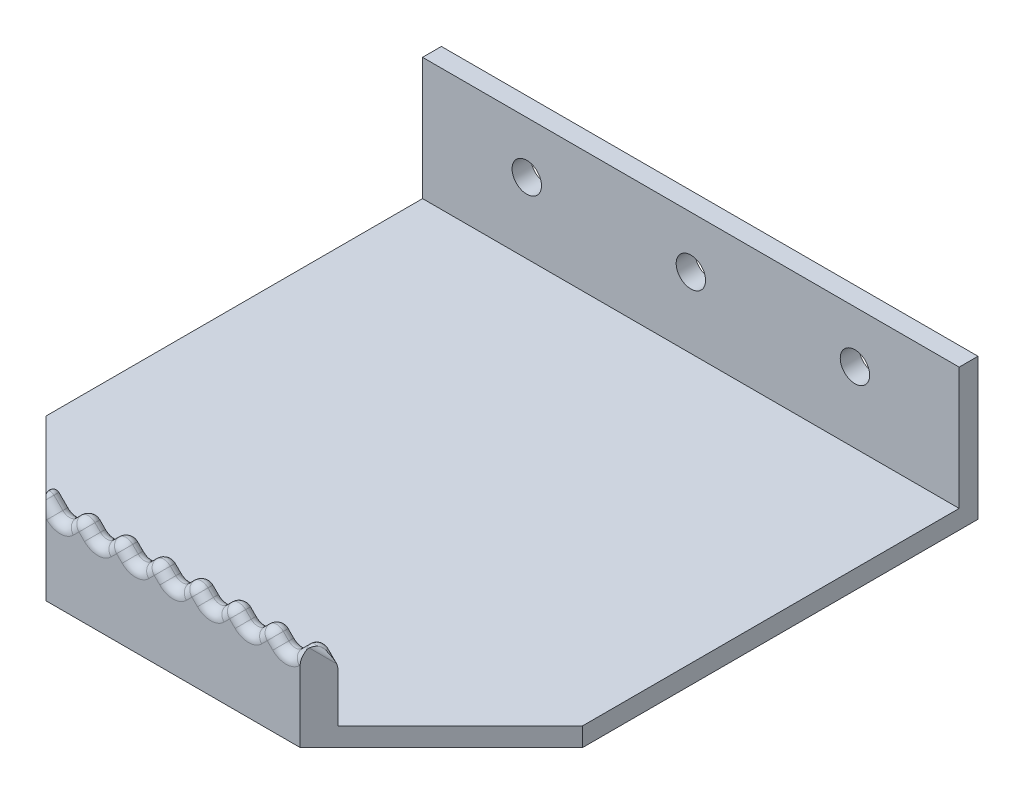
from build123d import *

# Parameters (mm, degrees)
SKETCH1_W           = 144.78
SKETCH1_H           = 38.1
BOSS_EXTRUDE1_DEPTH = 5.08
SKETCH2_W           = 144.78
SKETCH2_H           = 5.08
BOSS_EXTRUDE2_DEPTH = 139.7
CUT_EXTRUDE1_DEPTH  = 5.08
SKETCH5_R           = 3.9687500000000053
SKETCH5_R_2         = 3.9687499999999916
CUT_EXTRUDE2_DEPTH  = 5.08
BOSS_EXTRUDE3_DEPTH = 19.05
CUT_EXTRUDE3_START  = -5.08
CUT_EXTRUDE3_DEPTH  = 5.08
FILLET5_R           = 2.54
FILLET6_R           = 1.27


# Read off the part's stored shape, not the designer's step: Cut-Extrude3
with BuildPart() as part:
    # Sketch1 → Boss-Extrude1 (new body)
    with BuildSketch(Plane.XY):
        with Locations((72.39, 19.05)):
            Rectangle(SKETCH1_W, SKETCH1_H)
    extrude(amount=BOSS_EXTRUDE1_DEPTH)

    # Sketch2 → Boss-Extrude2 (add)
    with BuildSketch(Plane.XY.offset(5.08)):
        with Locations((72.39, 2.54)):
            Rectangle(SKETCH2_W, SKETCH2_H)
    extrude(amount=BOSS_EXTRUDE2_DEPTH)

    # Sketch4 → Cut-Extrude1 (cut)
    with BuildSketch(Plane(origin=(0, 5.08, 0), x_dir=(1, 0, 0), z_dir=(0, 1, 0))):
        Polygon((0, -144.78), (0, -106.67999999999999), (38.10000000000043, -144.78), align=None)
        Polygon((144.78, -144.78), (106.67999999999961, -144.78), (144.78, -106.67999999999999), align=None)
    extrude(amount=-CUT_EXTRUDE1_DEPTH, mode=Mode.SUBTRACT)

    # Sketch5 → Cut-Extrude2 (cut)
    with BuildSketch(Plane.XY.offset(5.08)):
        with Locations((72.39, 24.12999999999999)):
            Circle(SKETCH5_R)
        with Locations((28.117799999999992, 24.12999999999999)):
            Circle(SKETCH5_R)
        with Locations(Location((116.6622, 24.12999999999999, 0), (0, 0, 180))):
            Circle(SKETCH5_R_2)
    extrude(amount=-CUT_EXTRUDE2_DEPTH, mode=Mode.SUBTRACT)

    # Sketch6 → Boss-Extrude3 (add)
    with BuildSketch(Plane(origin=(0, 5.08, 0), x_dir=(1, 0, 0), z_dir=(0, 1, 0))):
        Polygon((38.10000000000043, -144.78), (106.67999999999961, -144.78), (111.76, -139.7), (33.020000000000444, -139.7), align=None)
    extrude(amount=BOSS_EXTRUDE3_DEPTH)

    # Cut-Extrude3 outline → Cut-Extrude3 (cut)
    with BuildSketch(Plane.XY.offset(144.78).offset(CUT_EXTRUDE3_START)):
        Polygon((77.47, 24.13), (67.31, 24.13), (72.39, 19.05), align=None)
        Polygon((118.11, 24.13), (107.95, 24.13), (113.03, 19.05), align=None)
        Polygon((107.95, 24.13), (97.79, 24.13), (102.87, 19.05), align=None)
        Polygon((97.79, 24.13), (87.63, 24.13), (92.71, 19.05), align=None)
        Polygon((87.63, 24.13), (77.47, 24.13), (82.55, 19.05), align=None)
        Polygon((62.23, 19.05), (67.31, 24.13), (57.15, 24.13), align=None)
        Polygon((31.75, 19.05), (36.83, 24.13), (26.67, 24.13), align=None)
        Polygon((41.91, 19.05), (46.99, 24.13), (36.83, 24.13), align=None)
        Polygon((52.07, 19.05), (57.15, 24.13), (46.99, 24.13), align=None)
    extrude(amount=CUT_EXTRUDE3_DEPTH, mode=Mode.SUBTRACT)

    # Fillet5
    # the kernel refuses this fillet: 2.54 mm, written as the material it adds along each edge
    with BuildSketch(Plane(origin=(72.39, 19.05, 139.7), x_dir=(-0.7071067811865475, 0.7071067811865475, 0), z_dir=(0, 0, 1))) as fillet5_piece_1:
        with BuildLine():
            CenterArc((FILLET5_R, -FILLET5_R), FILLET5_R, 90.00000000000011, 90.00000000000017)
            Line((-2.49e-15, -FILLET5_R), (0, 0))
            Line((0, 0), (FILLET5_R, 3e-17))
        make_face()
    extrude(amount=5.0800000000000125)
    with BuildSketch(Plane(origin=(52.07, 19.05, 139.7), x_dir=(-0.7071067811865482, 0.7071067811865469, 0), z_dir=(0, 0, 1))) as fillet5_piece_2:
        with BuildLine():
            CenterArc((FILLET5_R, -FILLET5_R), FILLET5_R, 89.9999999999999, 90.00000000000011)
            Line((-4.95e-15, -FILLET5_R), (0, 0))
            Line((0, 0), (FILLET5_R, 1.2e-16))
        make_face()
    extrude(amount=5.0800000000000125)
    with BuildSketch(Plane(origin=(82.55, 19.05, 139.7), x_dir=(-0.7071067811865482, 0.7071067811865468, 0), z_dir=(0, 0, 1))) as fillet5_piece_3:
        with BuildLine():
            CenterArc((FILLET5_R, -FILLET5_R), FILLET5_R, 90.00000000000006, 90.00000000000023)
            Line((-5.01e-15, -FILLET5_R), (0, 0))
            Line((0, 0), (FILLET5_R, -1.9e-16))
        make_face()
    extrude(amount=5.0800000000000125)
    with BuildSketch(Plane(origin=(62.23, 19.05, 139.7), x_dir=(-0.7071067811865475, 0.7071067811865475, 0), z_dir=(0, 0, 1))) as fillet5_piece_4:
        with BuildLine():
            CenterArc((FILLET5_R, -FILLET5_R), FILLET5_R, 89.99999999999994, 90)
            Line((-4.91e-15, -FILLET5_R), (0, 0))
            Line((0, 0), (FILLET5_R, 3e-17))
        make_face()
    extrude(amount=5.0800000000000125)
    with BuildSketch(Plane(origin=(41.91, 19.05, 139.7), x_dir=(-0.7071067811865468, 0.7071067811865482, 0), z_dir=(0, 0, 1))) as fillet5_piece_5:
        with BuildLine():
            CenterArc((FILLET5_R, -FILLET5_R), FILLET5_R, 90, 89.99999999999994)
            Line((-2.41e-15, -FILLET5_R), (0, 0))
            Line((0, 0), (FILLET5_R, 5e-17))
        make_face()
    extrude(amount=5.0800000000000125)
    with BuildSketch(Plane(origin=(102.87, 19.05, 139.7), x_dir=(0.7071067811865482, 0.7071067811865468, 0), z_dir=(0, 0, 1))) as fillet5_piece_6:
        with BuildLine():
            CenterArc((FILLET5_R, FILLET5_R), FILLET5_R, 180.0000000000001, 89.99999999999983)
            Line((-2.56e-15, FILLET5_R), (0, 0))
            Line((0, 0), (FILLET5_R, 1.9e-16))
        make_face()
    extrude(amount=5.0800000000000125)
    with BuildSketch(Plane(origin=(92.71, 19.05, 139.7), x_dir=(-0.7071067811865475, 0.7071067811865475, 0), z_dir=(0, 0, 1))) as fillet5_piece_7:
        with BuildLine():
            CenterArc((FILLET5_R, -FILLET5_R), FILLET5_R, 90.00000000000011, 89.99999999999974)
            Line((-2.54e-15, -FILLET5_R), (0, 0))
            Line((0, 0), (FILLET5_R, 3e-17))
        make_face()
    extrude(amount=5.0800000000000125)
    # the kernel refuses this fillet: 2.54 mm, written as the material it takes off along each edge
    with BuildSketch(Plane(origin=(57.15, 24.13, 133.35), x_dir=(-0.7071067811865469, -0.7071067811865483, 0), z_dir=(0, 0, 1))) as fillet5_2_piece_1:
        with BuildLine():
            CenterArc((FILLET5_R, FILLET5_R), FILLET5_R, 179.9999999999999, 90.00000000000011)
            Line((5.11e-15, FILLET5_R), (0, 0))
            Line((0, 0), (FILLET5_R, -1.5e-16))
        make_face()
    extrude(amount=17.78, mode=Mode.SUBTRACT)
    with BuildSketch(Plane(origin=(77.47, 24.13, 133.35000000000002), x_dir=(-0.7071067811865482, -0.7071067811865468, 0), z_dir=(0, 0, 1))) as fillet5_2_piece_2:
        with BuildLine():
            CenterArc((FILLET5_R, FILLET5_R), FILLET5_R, 180.0000000000001, 89.99999999999983)
            Line((-2.56e-15, FILLET5_R), (0, 0))
            Line((0, 0), (FILLET5_R, 1.9e-16))
        make_face()
    extrude(amount=17.779999999999944, mode=Mode.SUBTRACT)
    with BuildSketch(Plane(origin=(87.63, 24.129999999999995, 133.35000000000002), x_dir=(-0.7071067811865489, -0.7071067811865461, 0), z_dir=(0, 0, 1))) as fillet5_2_piece_3:
        with BuildLine():
            CenterArc((FILLET5_R, FILLET5_R), FILLET5_R, 180.00000000000014, 89.99999999999989)
            Line((-7.6e-15, FILLET5_R), (0, 0))
            Line((0, 0), (FILLET5_R, -2e-17))
        make_face()
    extrude(amount=17.779999999999944, mode=Mode.SUBTRACT)
    with BuildSketch(Plane(origin=(67.31, 24.13, 133.35000000000002), x_dir=(-0.7071067811865475, -0.7071067811865475, 0), z_dir=(0, 0, 1))) as fillet5_2_piece_4:
        with BuildLine():
            CenterArc((FILLET5_R, FILLET5_R), FILLET5_R, 180.0000000000001, 89.99999999999977)
            Line((-3e-17, FILLET5_R), (0, 0))
            Line((0, 0), (FILLET5_R, -3e-17))
        make_face()
    extrude(amount=17.779999999999944, mode=Mode.SUBTRACT)
    with BuildSketch(Plane(origin=(46.99, 24.13, 133.35), x_dir=(-0.7071067811865476, -0.7071067811865476, 0), z_dir=(0, 0, 1))) as fillet5_2_piece_5:
        with BuildLine():
            CenterArc((FILLET5_R, FILLET5_R), FILLET5_R, 179.99999999999994, 89.99999999999994)
            Line((7.48e-15, FILLET5_R), (0, 0))
            Line((0, 0), (FILLET5_R, 9e-17))
        make_face()
    extrude(amount=17.78, mode=Mode.SUBTRACT)
    with BuildSketch(Plane(origin=(97.79, 24.13, 133.35000000000002), x_dir=(-0.7071067811865489, -0.7071067811865461, 0), z_dir=(0, 0, 1))) as fillet5_2_piece_6:
        with BuildLine():
            CenterArc((FILLET5_R, FILLET5_R), FILLET5_R, 180.00000000000014, 89.99999999999989)
            Line((-7.6e-15, FILLET5_R), (0, 0))
            Line((0, 0), (FILLET5_R, -2e-17))
        make_face()
    extrude(amount=17.779999999999916, mode=Mode.SUBTRACT)
    # the kernel refuses this fillet: 2.54 mm, written as the material it takes off along each edge
    with BuildSketch(Plane(origin=(74.18605122421384, 20.84605122421384, 139.7), x_dir=(0.7071067811865476, -0.7071067811865476, 0), z_dir=(0.7071067811865476, 0.7071067811865476, 0)), Plane(origin=(84.34605122421384, 20.84605122421384, 139.7), x_dir=(0.7071067811865476, -0.7071067811865476, 0), z_dir=(0.7071067811865476, 0.7071067811865476, 0))) as fillet5_3_piece_1:
        with BuildLine():
            CenterArc((FILLET5_R, -FILLET5_R), FILLET5_R, 90, 90)
            Line((-2.51e-15, -FILLET5_R), (0, 0))
            Line((0, 0), (FILLET5_R, 0))
        make_face()
    extrude(amount=2.104204896855315, mode=Mode.SUBTRACT)
    with BuildSketch(Plane(origin=(69.10605122421383, 22.333948775786173, 139.7), x_dir=(-0.7071067811865476, -0.7071067811865476, 0), z_dir=(0.7071067811865476, -0.7071067811865476, 0)), Plane(origin=(89.42605122421382, 22.333948775786173, 139.7), x_dir=(-0.7071067811865476, -0.7071067811865476, 0), z_dir=(0.7071067811865476, -0.7071067811865476, 0))) as fillet5_3_piece_2:
        with BuildLine():
            CenterArc((FILLET5_R, -FILLET5_R), FILLET5_R, 90, 90)
            Line((0, -FILLET5_R), (0, 0))
            Line((0, 0), (FILLET5_R, 0))
        make_face()
    extrude(amount=2.1042048968553324, mode=Mode.SUBTRACT)
    with BuildSketch(Plane(origin=(69.10605122421383, 22.333948775786173, 144.78), x_dir=(-0.7071067811865476, -0.7071067811865476, 0), z_dir=(0.7071067811865476, -0.7071067811865476, 0)), Plane(origin=(89.42605122421382, 22.333948775786173, 144.78), x_dir=(-0.7071067811865476, -0.7071067811865476, 0), z_dir=(0.7071067811865476, -0.7071067811865476, 0))) as fillet5_3_piece_3:
        with BuildLine():
            CenterArc((FILLET5_R, FILLET5_R), FILLET5_R, 180, 90)
            Line((0, FILLET5_R), (0, 0))
            Line((0, 0), (FILLET5_R, 0))
        make_face()
    extrude(amount=2.1042048968553324, mode=Mode.SUBTRACT)
    with BuildSketch(Plane(origin=(74.18605122421384, 20.84605122421384, 144.78), x_dir=(0.7071067811865476, -0.7071067811865476, 0), z_dir=(0.7071067811865476, 0.7071067811865476, 0)), Plane(origin=(84.34605122421384, 20.84605122421384, 144.78), x_dir=(0.7071067811865476, -0.7071067811865476, 0), z_dir=(0.7071067811865476, 0.7071067811865476, 0))) as fillet5_3_piece_4:
        with BuildLine():
            CenterArc((FILLET5_R, FILLET5_R), FILLET5_R, 180, 90)
            Line((-2.51e-15, FILLET5_R), (0, 0))
            Line((0, 0), (FILLET5_R, 0))
        make_face()
    extrude(amount=2.104204896855315, mode=Mode.SUBTRACT)
    with BuildSketch(Plane(origin=(53.866051224213834, 20.846051224213834, 139.7), x_dir=(0.7071067811865476, -0.7071067811865476, 0), z_dir=(0.7071067811865476, 0.7071067811865476, 0))) as fillet5_3_piece_5:
        with BuildLine():
            CenterArc((FILLET5_R, -FILLET5_R), FILLET5_R, 90, 90)
            Line((0, -FILLET5_R), (0, 0))
            Line((0, 0), (FILLET5_R, 0))
        make_face()
    extrude(amount=2.1042048968553098, mode=Mode.SUBTRACT)
    with BuildSketch(Plane(origin=(48.786051224213836, 22.333948775786162, 139.7), x_dir=(-0.7071067811865476, -0.7071067811865476, 0), z_dir=(0.7071067811865476, -0.7071067811865476, 0))) as fillet5_3_piece_6:
        with BuildLine():
            CenterArc((FILLET5_R, -FILLET5_R), FILLET5_R, 90, 90)
            Line((7.54e-15, -FILLET5_R), (0, 0))
            Line((0, 0), (FILLET5_R, 0))
        make_face()
    extrude(amount=2.1042048968553124, mode=Mode.SUBTRACT)
    with BuildSketch(Plane(origin=(48.786051224213836, 22.333948775786162, 144.78), x_dir=(-0.7071067811865476, -0.7071067811865476, 0), z_dir=(0.7071067811865476, -0.7071067811865476, 0))) as fillet5_3_piece_7:
        with BuildLine():
            CenterArc((FILLET5_R, FILLET5_R), FILLET5_R, 180, 90)
            Line((0, FILLET5_R), (0, 0))
            Line((0, 0), (FILLET5_R, 0))
        make_face()
    extrude(amount=2.1042048968553124, mode=Mode.SUBTRACT)
    with BuildSketch(Plane(origin=(53.866051224213834, 20.846051224213834, 144.78), x_dir=(0.7071067811865476, -0.7071067811865476, 0), z_dir=(0.7071067811865476, 0.7071067811865476, 0))) as fillet5_3_piece_8:
        with BuildLine():
            CenterArc((FILLET5_R, FILLET5_R), FILLET5_R, 180, 90)
            Line((0, FILLET5_R), (0, 0))
            Line((0, 0), (FILLET5_R, 0))
        make_face()
    extrude(amount=2.1042048968553098, mode=Mode.SUBTRACT)
    with BuildSketch(Plane(origin=(79.26605122421383, 22.333948775786173, 139.7), x_dir=(-0.7071067811865476, -0.7071067811865476, 0), z_dir=(0.7071067811865476, -0.7071067811865476, 0)), Plane(origin=(99.58605122421383, 22.333948775786173, 139.7), x_dir=(-0.7071067811865476, -0.7071067811865476, 0), z_dir=(0.7071067811865476, -0.7071067811865476, 0))) as fillet5_3_piece_9:
        with BuildLine():
            CenterArc((FILLET5_R, -FILLET5_R), FILLET5_R, 90, 90)
            Line((0, -FILLET5_R), (0, 0))
            Line((0, 0), (FILLET5_R, 0))
        make_face()
    extrude(amount=2.104204896855335, mode=Mode.SUBTRACT)
    with BuildSketch(Plane(origin=(79.26605122421383, 22.333948775786173, 144.78), x_dir=(-0.7071067811865476, -0.7071067811865476, 0), z_dir=(0.7071067811865476, -0.7071067811865476, 0)), Plane(origin=(99.58605122421383, 22.333948775786173, 144.78), x_dir=(-0.7071067811865476, -0.7071067811865476, 0), z_dir=(0.7071067811865476, -0.7071067811865476, 0))) as fillet5_3_piece_10:
        with BuildLine():
            CenterArc((FILLET5_R, FILLET5_R), FILLET5_R, 180, 90)
            Line((0, FILLET5_R), (0, 0))
            Line((0, 0), (FILLET5_R, 0))
        make_face()
    extrude(amount=2.104204896855335, mode=Mode.SUBTRACT)
    with BuildSketch(Plane(origin=(64.02605122421383, 20.846051224213827, 139.7), x_dir=(0.7071067811865471, -0.707106781186548, 0), z_dir=(0.707106781186548, 0.707106781186547, 0))) as fillet5_3_piece_11:
        with BuildLine():
            CenterArc((FILLET5_R, -FILLET5_R), FILLET5_R, 90, 90)
            Line((-2.51e-15, -FILLET5_R), (0, 0))
            Line((0, 0), (FILLET5_R, 0))
        make_face()
    extrude(amount=2.1042048968553324, mode=Mode.SUBTRACT)
    with BuildSketch(Plane(origin=(58.94605122421383, 22.333948775786162, 139.7), x_dir=(-0.7071067811865476, -0.7071067811865476, 0), z_dir=(0.7071067811865476, -0.7071067811865476, 0))) as fillet5_3_piece_12:
        with BuildLine():
            CenterArc((FILLET5_R, -FILLET5_R), FILLET5_R, 90, 90)
            Line((2.51e-15, -FILLET5_R), (0, 0))
            Line((0, 0), (FILLET5_R, 0))
        make_face()
    extrude(amount=2.1042048968553226, mode=Mode.SUBTRACT)
    with BuildSketch(Plane(origin=(58.94605122421383, 22.333948775786162, 144.78), x_dir=(-0.7071067811865476, -0.7071067811865476, 0), z_dir=(0.7071067811865476, -0.7071067811865476, 0))) as fillet5_3_piece_13:
        with BuildLine():
            CenterArc((FILLET5_R, FILLET5_R), FILLET5_R, 180, 90)
            Line((2.51e-15, FILLET5_R), (0, 0))
            Line((0, 0), (FILLET5_R, 0))
        make_face()
    extrude(amount=2.1042048968553226, mode=Mode.SUBTRACT)
    with BuildSketch(Plane(origin=(64.02605122421383, 20.846051224213827, 144.78), x_dir=(0.7071067811865471, -0.707106781186548, 0), z_dir=(0.707106781186548, 0.707106781186547, 0))) as fillet5_3_piece_14:
        with BuildLine():
            CenterArc((FILLET5_R, FILLET5_R), FILLET5_R, 180, 90)
            Line((-2.51e-15, FILLET5_R), (0, 0))
            Line((0, 0), (FILLET5_R, 0))
        make_face()
    extrude(amount=2.1042048968553324, mode=Mode.SUBTRACT)
    with BuildSketch(Plane(origin=(32.339871939465425, 28.62012806053456, 139.7), x_dir=(-0.7071067811865475, -0.7071067811865475, 0), z_dir=(0.7071067811865476, -0.7071067811865476, 0))) as fillet5_3_piece_15:
        with BuildLine():
            CenterArc((FILLET5_R, -FILLET5_R), FILLET5_R, 90, 90)
            Line((-2.51e-15, -FILLET5_R), (0, 0))
            Line((0, 0), (FILLET5_R, 0))
        make_face()
    extrude(amount=10.994204896855315, mode=Mode.SUBTRACT)
    with BuildSketch(Plane(origin=(33.609871939465854, 27.350128060534143, 144.78), x_dir=(-0.7071067811865476, -0.7071067811865476, 0), z_dir=(0.7071067811865476, -0.7071067811865476, 0))) as fillet5_3_piece_16:
        with BuildLine():
            CenterArc((FILLET5_R, FILLET5_R), FILLET5_R, 180, 90)
            Line((0, FILLET5_R), (0, 0))
            Line((0, 0), (FILLET5_R, 0))
        make_face()
    extrude(amount=9.198153672640885, mode=Mode.SUBTRACT)
    with BuildSketch(Plane(origin=(43.70605122421383, 20.84605122421383, 144.78), x_dir=(0.7071067811865471, -0.707106781186548, 0), z_dir=(0.707106781186548, 0.707106781186547, 0))) as fillet5_3_piece_17:
        with BuildLine():
            CenterArc((FILLET5_R, FILLET5_R), FILLET5_R, 180, 90)
            Line((-2.51e-15, FILLET5_R), (0, 0))
            Line((0, 0), (FILLET5_R, 0))
        make_face()
    extrude(amount=2.10420489685532, mode=Mode.SUBTRACT)
    with BuildSketch(Plane(origin=(43.70605122421383, 20.84605122421383, 139.7), x_dir=(0.707106781186547, -0.7071067811865481, 0), z_dir=(0.707106781186548, 0.707106781186547, 0))) as fillet5_3_piece_18:
        with BuildLine():
            CenterArc((FILLET5_R, -FILLET5_R), FILLET5_R, 90, 90)
            Line((0, -FILLET5_R), (0, 0))
            Line((0, 0), (FILLET5_R, 0))
        make_face()
    extrude(amount=2.10420489685532, mode=Mode.SUBTRACT)
    with BuildSketch(Plane(origin=(104.66605122421383, 20.846051224213827, 144.78), x_dir=(0.7071067811865476, -0.7071067811865476, 0), z_dir=(0.7071067811865476, 0.7071067811865476, 0))) as fillet5_3_piece_19:
        with BuildLine():
            CenterArc((FILLET5_R, FILLET5_R), FILLET5_R, 180, 90)
            Line((-2.51e-15, FILLET5_R), (0, 0))
            Line((0, 0), (FILLET5_R, 0))
        make_face()
    extrude(amount=9.198153672640936, mode=Mode.SUBTRACT)
    with BuildSketch(Plane(origin=(104.66605122421383, 20.846051224213827, 139.7), x_dir=(-7e-16, 7e-16, 1), z_dir=(0.7071067811865476, 0.7071067811865476, 0))) as fillet5_3_piece_20:
        with BuildLine():
            CenterArc((FILLET5_R, FILLET5_R), FILLET5_R, 180.00000000000006, 90)
            Line((-2.51e-15, FILLET5_R), (0, 0))
            Line((0, 0), (FILLET5_R, 0))
        make_face()
    extrude(amount=10.994204896855322, mode=Mode.SUBTRACT)
    with BuildSketch(Plane(origin=(94.50605122421382, 20.846051224213824, 139.7), x_dir=(0.7071067811865465, -0.7071067811865486, 0), z_dir=(0.7071067811865486, 0.7071067811865466, 0))) as fillet5_3_piece_21:
        with BuildLine():
            CenterArc((FILLET5_R, -FILLET5_R), FILLET5_R, 90, 90)
            Line((0, -FILLET5_R), (0, 0))
            Line((0, 0), (FILLET5_R, 0))
        make_face()
    extrude(amount=2.10420489685535, mode=Mode.SUBTRACT)
    with BuildSketch(Plane(origin=(94.50605122421382, 20.846051224213824, 144.78), x_dir=(0.7071067811865465, -0.7071067811865486, 0), z_dir=(0.7071067811865486, 0.7071067811865466, 0))) as fillet5_3_piece_22:
        with BuildLine():
            CenterArc((FILLET5_R, FILLET5_R), FILLET5_R, 180, 90)
            Line((0, FILLET5_R), (0, 0))
            Line((0, 0), (FILLET5_R, 0))
        make_face()
    extrude(amount=2.10420489685535, mode=Mode.SUBTRACT)
    with BuildSketch(Plane(origin=(92.71, 22.64210244842766, 144.78), x_dir=(-0.7071067811865461, -0.7071067811865489, 0), z_dir=(-0.7071067811865489, 0.7071067811865461, 0))) as fillet5_3_piece_23:
        with BuildLine():
            CenterArc((2.539999999999999 + FILLET5_R, -FILLET5_R), FILLET5_R, 90, 90)
            Line((2.539999999999999, -FILLET5_R), (2.539999999999999, 0))
            Line((2.539999999999999, 0), (2.539999999999999 + FILLET5_R, 0))
        make_face()
    revolve(axis=Axis((92.71, 22.64210244842766, 144.78), (0, 0, 1)), revolution_arc=89.99999999999972, mode=Mode.SUBTRACT)
    with BuildSketch(Plane(origin=(97.79, 20.537897551572346, 144.78), x_dir=(-0.7071067811865461, 0.7071067811865489, 0), z_dir=(-0.7071067811865489, -0.7071067811865461, 0))) as fillet5_3_piece_24:
        with BuildLine():
            CenterArc((2.539999999999999 - FILLET5_R, FILLET5_R), FILLET5_R, 270, 90)
            Line((2.539999999999999, FILLET5_R), (2.539999999999999, 0))
            Line((2.539999999999999, 0), (2.539999999999999 - FILLET5_R, 0))
        make_face()
    revolve(axis=Axis((97.79, 20.537897551572346, 144.78), (0, 0, -1)), revolution_arc=89.99999999999977, mode=Mode.SUBTRACT)
    with BuildSketch(Plane(origin=(87.63, 20.537897551572343, 144.78), x_dir=(-0.7071067811865461, 0.7071067811865489, 0), z_dir=(-0.7071067811865489, -0.7071067811865461, 0))) as fillet5_3_piece_25:
        with BuildLine():
            CenterArc((2.539999999999999 - FILLET5_R, FILLET5_R), FILLET5_R, 270, 90)
            Line((2.539999999999999, FILLET5_R), (2.539999999999999, 0))
            Line((2.539999999999999, 0), (2.539999999999999 - FILLET5_R, 0))
        make_face()
    revolve(axis=Axis((87.63, 20.537897551572343, 144.78), (0, 0, -1)), revolution_arc=89.99999999999977, mode=Mode.SUBTRACT)
    with BuildSketch(Plane(origin=(87.63, 20.537897551572343, 139.7), x_dir=(-0.7071067811865461, 0.7071067811865489, 0), z_dir=(-0.7071067811865489, -0.7071067811865461, 0))) as fillet5_3_piece_26:
        with BuildLine():
            CenterArc((2.539999999999999 - FILLET5_R, -FILLET5_R), FILLET5_R, 0, 90)
            Line((2.539999999999999, -FILLET5_R), (2.539999999999999, 0))
            Line((2.539999999999999, 0), (2.539999999999999 - FILLET5_R, 0))
        make_face()
    revolve(axis=Axis((87.63, 20.537897551572343, 139.7), (0, 0, -1)), revolution_arc=89.99999999999977, mode=Mode.SUBTRACT)
    with BuildSketch(Plane(origin=(92.71, 22.64210244842766, 139.7), x_dir=(-0.7071067811865461, -0.7071067811865489, 0), z_dir=(-0.7071067811865489, 0.7071067811865461, 0))) as fillet5_3_piece_27:
        with BuildLine():
            CenterArc((2.539999999999999 + FILLET5_R, FILLET5_R), FILLET5_R, 180, 90)
            Line((2.539999999999999, FILLET5_R), (2.539999999999999, 0))
            Line((2.539999999999999, 0), (2.539999999999999 + FILLET5_R, 0))
        make_face()
    revolve(axis=Axis((92.71, 22.64210244842766, 139.7), (0, 0, 1)), revolution_arc=89.99999999999972, mode=Mode.SUBTRACT)
    with BuildSketch(Plane(origin=(97.79, 20.537897551572346, 139.7), x_dir=(-0.7071067811865461, 0.7071067811865489, 0), z_dir=(-0.7071067811865489, -0.7071067811865461, 0))) as fillet5_3_piece_28:
        with BuildLine():
            CenterArc((2.539999999999999 - FILLET5_R, -FILLET5_R), FILLET5_R, 0, 90)
            Line((2.539999999999999, -FILLET5_R), (2.539999999999999, 0))
            Line((2.539999999999999, 0), (2.539999999999999 - FILLET5_R, 0))
        make_face()
    revolve(axis=Axis((97.79, 20.537897551572346, 139.7), (0, 0, -1)), revolution_arc=89.99999999999977, mode=Mode.SUBTRACT)
    with BuildSketch(Plane(origin=(102.87, 22.642102448427657, 139.7), x_dir=(0.7071067811865461, -0.7071067811865489, 0), z_dir=(0.7071067811865489, 0.7071067811865461, 0))) as fillet5_3_piece_29:
        with BuildLine():
            CenterArc((2.539999999999999 + FILLET5_R, -FILLET5_R), FILLET5_R, 90, 90)
            Line((2.539999999999999, -FILLET5_R), (2.539999999999999, 0))
            Line((2.539999999999999, 0), (2.539999999999999 + FILLET5_R, 0))
        make_face()
    revolve(axis=Axis((102.87, 22.642102448427657, 139.7), (0, 0, -1)), revolution_arc=89.99999999999983, mode=Mode.SUBTRACT)
    with BuildSketch(Plane(origin=(102.87, 22.642102448427657, 144.78), x_dir=(0.7071067811865461, -0.7071067811865489, 0), z_dir=(0.7071067811865489, 0.7071067811865461, 0))) as fillet5_3_piece_30:
        with BuildLine():
            CenterArc((2.539999999999999 + FILLET5_R, FILLET5_R), FILLET5_R, 180, 90)
            Line((2.539999999999999, FILLET5_R), (2.539999999999999, 0))
            Line((2.539999999999999, 0), (2.539999999999999 + FILLET5_R, 0))
        make_face()
    revolve(axis=Axis((102.87, 22.642102448427657, 144.78), (0, 0, -1)), revolution_arc=89.99999999999983, mode=Mode.SUBTRACT)
    with BuildSketch(Plane(origin=(41.910000000000004, 22.64210244842766, 139.7), x_dir=(-0.7071067811865482, -0.7071067811865469, 0), z_dir=(-0.7071067811865469, 0.7071067811865482, 0))) as fillet5_3_piece_31:
        with BuildLine():
            CenterArc((2.540000000000002 + FILLET5_R, FILLET5_R), FILLET5_R, 180, 90)
            Line((2.5400000000000094, FILLET5_R), (2.540000000000002, 0))
            Line((2.540000000000002, 0), (2.540000000000002 + FILLET5_R, 0))
        make_face()
    revolve(axis=Axis((41.910000000000004, 22.64210244842766, 139.7), (0, 0, 1)), revolution_arc=89.99999999999994, mode=Mode.SUBTRACT)
    with BuildSketch(Plane(origin=(46.989999999999995, 20.537897551572332, 139.7), x_dir=(-0.7071067811865461, 0.7071067811865489, 0), z_dir=(-0.7071067811865489, -0.7071067811865461, 0))) as fillet5_3_piece_32:
        with BuildLine():
            CenterArc((2.539999999999999 - FILLET5_R, -FILLET5_R), FILLET5_R, 0, 90)
            Line((2.539999999999999, -FILLET5_R), (2.539999999999999, 0))
            Line((2.539999999999999, 0), (2.539999999999999 - FILLET5_R, 0))
        make_face()
    revolve(axis=Axis((46.989999999999995, 20.537897551572332, 139.7), (0, 0, -1)), revolution_arc=89.99999999999993, mode=Mode.SUBTRACT)
    with BuildSketch(Plane(origin=(41.910000000000004, 22.64210244842766, 144.78), x_dir=(-0.7071067811865482, -0.7071067811865469, 0), z_dir=(-0.7071067811865469, 0.7071067811865482, 0))) as fillet5_3_piece_33:
        with BuildLine():
            CenterArc((2.540000000000002 + FILLET5_R, -FILLET5_R), FILLET5_R, 90, 90)
            Line((2.540000000000002, -FILLET5_R), (2.540000000000002, 0))
            Line((2.540000000000002, 0), (2.540000000000002 + FILLET5_R, 0))
        make_face()
    revolve(axis=Axis((41.910000000000004, 22.64210244842766, 144.78), (0, 0, 1)), revolution_arc=89.99999999999994, mode=Mode.SUBTRACT)
    with BuildSketch(Plane(origin=(46.989999999999995, 20.537897551572332, 144.78), x_dir=(-0.7071067811865461, 0.7071067811865489, 0), z_dir=(-0.7071067811865489, -0.7071067811865461, 0))) as fillet5_3_piece_34:
        with BuildLine():
            CenterArc((2.539999999999999 - FILLET5_R, FILLET5_R), FILLET5_R, 270, 90)
            Line((2.539999999999999, FILLET5_R), (2.539999999999999, 0))
            Line((2.539999999999999, 0), (2.539999999999999 - FILLET5_R, 0))
        make_face()
    revolve(axis=Axis((46.989999999999995, 20.537897551572332, 144.78), (0, 0, -1)), revolution_arc=89.99999999999993, mode=Mode.SUBTRACT)
    with BuildSketch(Plane(origin=(62.230000000000004, 22.642102448427654, 144.78), x_dir=(-0.7071067811865482, -0.7071067811865469, 0), z_dir=(-0.7071067811865469, 0.7071067811865482, 0))) as fillet5_3_piece_35:
        with BuildLine():
            CenterArc((2.540000000000002 + FILLET5_R, -FILLET5_R), FILLET5_R, 90, 90)
            Line((2.539999999999999, -FILLET5_R), (2.540000000000002, 0))
            Line((2.540000000000002, 0), (2.540000000000002 + FILLET5_R, 0))
        make_face()
    revolve(axis=Axis((62.230000000000004, 22.642102448427654, 144.78), (0, 0, 1)), revolution_arc=90, mode=Mode.SUBTRACT)
    with BuildSketch(Plane(origin=(67.31, 20.53789755157234, 144.78), x_dir=(-0.7071067811865461, 0.7071067811865489, 0), z_dir=(-0.7071067811865489, -0.7071067811865461, 0))) as fillet5_3_piece_36:
        with BuildLine():
            CenterArc((2.539999999999999 - FILLET5_R, FILLET5_R), FILLET5_R, 270, 90)
            Line((2.539999999999999, FILLET5_R), (2.539999999999999, 0))
            Line((2.539999999999999, 0), (2.539999999999999 - FILLET5_R, 0))
        make_face()
    revolve(axis=Axis((67.31, 20.53789755157234, 144.78), (0, 0, -1)), revolution_arc=89.99999999999977, mode=Mode.SUBTRACT)
    with BuildSketch(Plane(origin=(57.15, 20.537897551572332, 144.78), x_dir=(-0.7071067811865482, 0.7071067811865469, 0), z_dir=(-0.7071067811865469, -0.7071067811865482, 0))) as fillet5_3_piece_37:
        with BuildLine():
            CenterArc((2.540000000000002 - FILLET5_R, FILLET5_R), FILLET5_R, 270, 90)
            Line((2.540000000000002, FILLET5_R), (2.540000000000002, 0))
            Line((2.540000000000002, 0), (2.540000000000002 - FILLET5_R, 0))
        make_face()
    revolve(axis=Axis((57.15, 20.537897551572332, 144.78), (0, 0, -1)), revolution_arc=90.0000000000001, mode=Mode.SUBTRACT)
    with BuildSketch(Plane(origin=(57.15, 20.537897551572332, 139.7), x_dir=(-0.7071067811865482, 0.7071067811865469, 0), z_dir=(-0.7071067811865469, -0.7071067811865482, 0))) as fillet5_3_piece_38:
        with BuildLine():
            CenterArc((2.540000000000002 - FILLET5_R, -FILLET5_R), FILLET5_R, 0, 90)
            Line((2.540000000000002, -FILLET5_R), (2.540000000000002, 0))
            Line((2.540000000000002, 0), (2.540000000000002 - FILLET5_R, 0))
        make_face()
    revolve(axis=Axis((57.15, 20.537897551572332, 139.7), (0, 0, -1)), revolution_arc=90.0000000000001, mode=Mode.SUBTRACT)
    with BuildSketch(Plane(origin=(62.230000000000004, 22.642102448427654, 139.7), x_dir=(-0.7071067811865482, -0.7071067811865469, 0), z_dir=(-0.7071067811865469, 0.7071067811865482, 0))) as fillet5_3_piece_39:
        with BuildLine():
            CenterArc((2.540000000000002 + FILLET5_R, FILLET5_R), FILLET5_R, 180, 90)
            Line((2.539999999999999, FILLET5_R), (2.540000000000002, 0))
            Line((2.540000000000002, 0), (2.540000000000002 + FILLET5_R, 0))
        make_face()
    revolve(axis=Axis((62.230000000000004, 22.642102448427654, 139.7), (0, 0, 1)), revolution_arc=90, mode=Mode.SUBTRACT)
    with BuildSketch(Plane(origin=(67.31, 20.53789755157234, 139.7), x_dir=(-0.7071067811865461, 0.7071067811865489, 0), z_dir=(-0.7071067811865489, -0.7071067811865461, 0))) as fillet5_3_piece_40:
        with BuildLine():
            CenterArc((2.539999999999999 - FILLET5_R, -FILLET5_R), FILLET5_R, 0, 90)
            Line((2.539999999999999, -FILLET5_R), (2.539999999999999, 0))
            Line((2.539999999999999, 0), (2.539999999999999 - FILLET5_R, 0))
        make_face()
    revolve(axis=Axis((67.31, 20.53789755157234, 139.7), (0, 0, -1)), revolution_arc=89.99999999999977, mode=Mode.SUBTRACT)
    with BuildSketch(Plane(origin=(82.55, 22.642102448427657, 144.78), x_dir=(-0.7071067811865461, -0.7071067811865489, 0), z_dir=(-0.7071067811865489, 0.7071067811865461, 0))) as fillet5_3_piece_41:
        with BuildLine():
            CenterArc((2.539999999999999 + FILLET5_R, -FILLET5_R), FILLET5_R, 90, 90)
            Line((2.540000000000004, -FILLET5_R), (2.539999999999999, 0))
            Line((2.539999999999999, 0), (2.539999999999999 + FILLET5_R, 0))
        make_face()
    revolve(axis=Axis((82.55, 22.642102448427657, 144.78), (0, 0, 1)), revolution_arc=90.00000000000023, mode=Mode.SUBTRACT)
    with BuildSketch(Plane(origin=(77.47, 20.537897551572343, 144.78), x_dir=(-0.7071067811865461, 0.7071067811865489, 0), z_dir=(-0.7071067811865489, -0.7071067811865461, 0))) as fillet5_3_piece_42:
        with BuildLine():
            CenterArc((2.539999999999999 - FILLET5_R, FILLET5_R), FILLET5_R, 270, 90)
            Line((2.539999999999999, FILLET5_R), (2.539999999999999, 0))
            Line((2.539999999999999, 0), (2.539999999999999 - FILLET5_R, 0))
        make_face()
    revolve(axis=Axis((77.47, 20.537897551572343, 144.78), (0, 0, -1)), revolution_arc=89.99999999999977, mode=Mode.SUBTRACT)
    with BuildSketch(Plane(origin=(82.55, 22.642102448427657, 139.7), x_dir=(-0.7071067811865461, -0.7071067811865489, 0), z_dir=(-0.7071067811865489, 0.7071067811865461, 0))) as fillet5_3_piece_43:
        with BuildLine():
            CenterArc((2.539999999999999 + FILLET5_R, FILLET5_R), FILLET5_R, 180, 90)
            Line((2.540000000000004, FILLET5_R), (2.539999999999999, 0))
            Line((2.539999999999999, 0), (2.539999999999999 + FILLET5_R, 0))
        make_face()
    revolve(axis=Axis((82.55, 22.642102448427657, 139.7), (0, 0, 1)), revolution_arc=90.00000000000023, mode=Mode.SUBTRACT)
    with BuildSketch(Plane(origin=(77.47, 20.537897551572343, 139.7), x_dir=(-0.7071067811865461, 0.7071067811865489, 0), z_dir=(-0.7071067811865489, -0.7071067811865461, 0))) as fillet5_3_piece_44:
        with BuildLine():
            CenterArc((2.539999999999999 - FILLET5_R, -FILLET5_R), FILLET5_R, 0, 90)
            Line((2.539999999999999, -FILLET5_R), (2.539999999999999, 0))
            Line((2.539999999999999, 0), (2.539999999999999 - FILLET5_R, 0))
        make_face()
    revolve(axis=Axis((77.47, 20.537897551572343, 139.7), (0, 0, -1)), revolution_arc=89.99999999999977, mode=Mode.SUBTRACT)
    with BuildSketch(Plane(origin=(52.06999999999999, 22.64210244842766, 144.78), x_dir=(-0.7071067811865482, -0.7071067811865469, 0), z_dir=(-0.7071067811865469, 0.7071067811865482, 0))) as fillet5_3_piece_45:
        with BuildLine():
            CenterArc((2.540000000000002 + FILLET5_R, -FILLET5_R), FILLET5_R, 90, 90)
            Line((2.540000000000002, -FILLET5_R), (2.540000000000002, 0))
            Line((2.540000000000002, 0), (2.540000000000002 + FILLET5_R, 0))
        make_face()
    revolve(axis=Axis((52.06999999999999, 22.64210244842766, 144.78), (0, 0, 1)), revolution_arc=90.00000000000013, mode=Mode.SUBTRACT)
    with BuildSketch(Plane(origin=(52.06999999999999, 22.64210244842766, 139.7), x_dir=(-0.7071067811865482, -0.7071067811865469, 0), z_dir=(-0.7071067811865469, 0.7071067811865482, 0))) as fillet5_3_piece_46:
        with BuildLine():
            CenterArc((2.540000000000002 + FILLET5_R, FILLET5_R), FILLET5_R, 180, 90)
            Line((2.540000000000002, FILLET5_R), (2.540000000000002, 0))
            Line((2.540000000000002, 0), (2.540000000000002 + FILLET5_R, 0))
        make_face()
    revolve(axis=Axis((52.06999999999999, 22.64210244842766, 139.7), (0, 0, 1)), revolution_arc=90.00000000000013, mode=Mode.SUBTRACT)
    with BuildSketch(Plane(origin=(72.39, 22.64210244842766, 144.78), x_dir=(-0.7071067811865461, -0.7071067811865489, 0), z_dir=(-0.7071067811865489, 0.7071067811865461, 0))) as fillet5_3_piece_47:
        with BuildLine():
            CenterArc((2.539999999999999 + FILLET5_R, -FILLET5_R), FILLET5_R, 90, 90)
            Line((2.539999999999999, -FILLET5_R), (2.539999999999999, 0))
            Line((2.539999999999999, 0), (2.539999999999999 + FILLET5_R, 0))
        make_face()
    revolve(axis=Axis((72.39, 22.64210244842766, 144.78), (0, 0, 1)), revolution_arc=90.00000000000018, mode=Mode.SUBTRACT)
    with BuildSketch(Plane(origin=(72.39, 22.64210244842766, 139.7), x_dir=(-0.7071067811865461, -0.7071067811865489, 0), z_dir=(-0.7071067811865489, 0.7071067811865461, 0))) as fillet5_3_piece_48:
        with BuildLine():
            CenterArc((2.539999999999999 + FILLET5_R, FILLET5_R), FILLET5_R, 180, 90)
            Line((2.539999999999999, FILLET5_R), (2.539999999999999, 0))
            Line((2.539999999999999, 0), (2.539999999999999 + FILLET5_R, 0))
        make_face()
    revolve(axis=Axis((72.39, 22.64210244842766, 139.7), (0, 0, 1)), revolution_arc=90.00000000000018, mode=Mode.SUBTRACT)

    # Fillet6
    # the kernel refuses this fillet: 1.27 mm, written as the material it takes off along each edge
    with BuildSketch(Plane(origin=(112.81833333333302, 19.261666666666976, 138.64166666666665), x_dir=(-0.4082482904638644, -0.8164965809277247, 0.4082482904638644), z_dir=(-0.5773502691896277, 0.5773502691896277, 0.577350269189622))) as fillet6_piece_1:
        with BuildLine():
            CenterArc((FILLET6_R * 0.57735026919, -FILLET6_R), FILLET6_R, 89.99999999999974, 60.0000000000006)
            Line((-FILLET6_R * 0.288675134595, -FILLET6_R * 0.5), (0, 0))
            Line((0, 0), (FILLET6_R * 0.57735026919, -3e-17))
        make_face()
    extrude(amount=9.961571970282257, mode=Mode.SUBTRACT)
    with BuildSketch(Plane(origin=(109.74605122421383, 22.333948775786173, 142.24), x_dir=(0.08857401095787952, -0.08857401095787952, 0.9921236259487357), z_dir=(0.7015373436837361, -0.7015373436837375, -0.12526256757041637))) as fillet6_piece_2:
        with BuildLine():
            CenterArc((2.539999999999977 - FILLET6_R, FILLET6_R), FILLET6_R, 270, 90.00000000000011)
            Line((2.539999999999977 - FILLET6_R, -1.005e-14), (2.539999999999977, -5.02e-15))
            Line((2.539999999999977, -5.02e-15), (2.539999999999976, FILLET6_R))
        make_face()
    revolve(axis=Axis((109.74605122421383, 22.333948775786173, 142.24), (-0.7071067811865482, -0.7071067811865468, 0)), revolution_arc=187.19591897490582, mode=Mode.SUBTRACT)
    with BuildSketch(Plane(origin=(37.71298292526244, 25.012982925262442, 144.392982925262), x_dir=(0.40824829046386446, -0.8164965809277246, 0.40824829046386446), z_dir=(-0.5773502691896278, -0.5773502691896278, -0.5773502691896216))) as fillet6_piece_3:
        with BuildLine():
            CenterArc((FILLET6_R * 0.57735026919, -FILLET6_R), FILLET6_R, 89.99999999999987, 60.00000000000027)
            Line((-FILLET6_R * 0.288675134595, -FILLET6_R * 0.5), (0, 0))
            Line((0, 0), (FILLET6_R * 0.57735026919, 1e-17))
        make_face()
    extrude(amount=9.9615719702842, mode=Mode.SUBTRACT)
    with BuildSketch(Plane(origin=(35.033948775786165, 22.33394877578617, 142.23999999999998), x_dir=(0, 0, -1), z_dir=(-0.7071067811865482, -0.7071067811865469, 0))) as fillet6_piece_4:
        with BuildLine():
            CenterArc((2.539999999999992 - FILLET6_R, FILLET6_R), FILLET6_R, 270, 90.00000000000011)
            Line((2.539999999999992 - FILLET6_R, 0), (2.539999999999992, 0))
            Line((2.539999999999992, 0), (2.539999999999992, FILLET6_R))
        make_face()
    revolve(axis=Axis((35.033948775786165, 22.33394877578617, 142.23999999999998), (0.7071067811865469, -0.7071067811865482, 0)), revolution_arc=187.19591897491324, mode=Mode.SUBTRACT)
    with BuildSketch(Plane(origin=(30.774935969733136, 18.074935969733136, 139.7), x_dir=(0, 0, 1), z_dir=(0.7071067811865476, 0.7071067811865476, 0))) as fillet6_piece_5:
        with BuildLine():
            CenterArc((FILLET6_R, FILLET6_R), FILLET6_R, 179.9999999999999, 90.00000000000011)
            Line((0, FILLET6_R), (0, 0))
            Line((0, 0), (FILLET6_R, 0))
        make_face()
    extrude(amount=6.023153672640889, mode=Mode.SUBTRACT)
    with BuildSketch(Plane(origin=(109.74605122421383, 22.333948775786173, 139.7), x_dir=(-2.8e-15, -2.8e-15, 1), z_dir=(0.7071067811865476, -0.7071067811865476, 0))) as fillet6_piece_6:
        with BuildLine():
            CenterArc((FILLET6_R, FILLET6_R), FILLET6_R, 180.00000000000057, 89.9999999999992)
            Line((5.02e-15, FILLET6_R), (0, 0))
            Line((0, 0), (FILLET6_R, 0))
        make_face()
    extrude(amount=6.0231536726415245, mode=Mode.SUBTRACT)


solid = part.part
